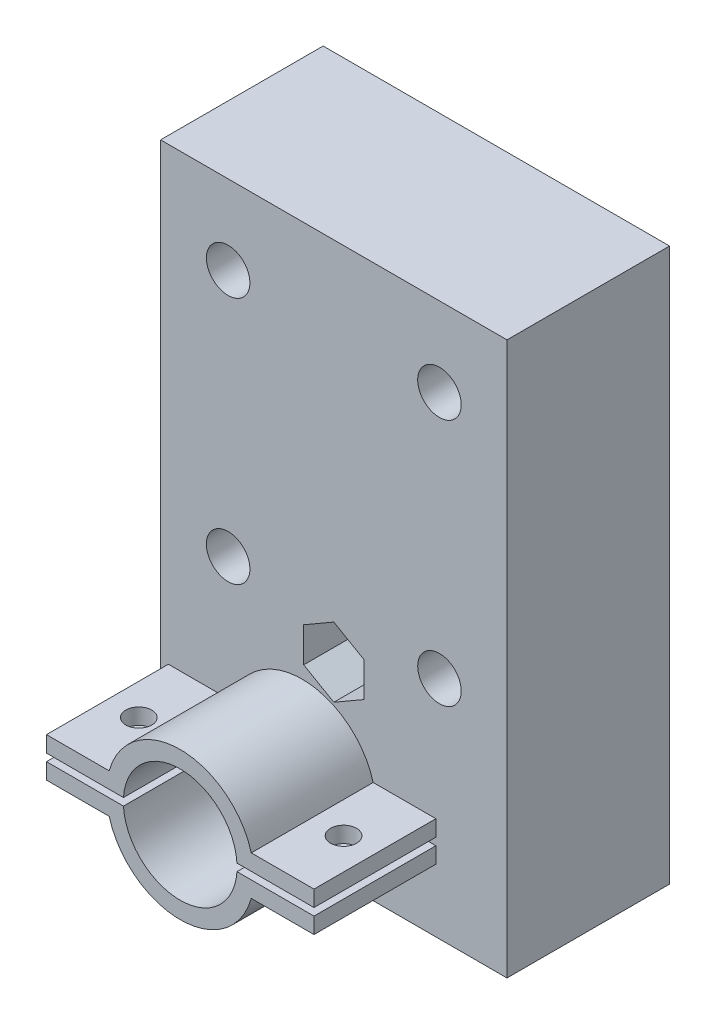
from build123d import *

# Parameters (mm, degrees)
SKETCH1_W           = 42.62295082
SKETCH1_H           = 50
SKETCH1_R           = 2.677018134
BOSS_EXTRUDE1_DEPTH = 20
SKETCH2_R           = 8.73
CUT_EXTRUDE2_DEPTH  = 7.94
SKETCH3_R           = 2.2
CUT_EXTRUDE3_DEPTH  = 10
CUT_EXTRUDE4_START  = -7
CUT_EXTRUDE4_DEPTH  = 32.460095998
SKETCH7_W           = 42.62295082
SKETCH7_H           = 20
BOSS_EXTRUDE2_DEPTH = 18
SKETCH6_R           = 6.4
CUT_EXTRUDE5_DEPTH  = 52.992105017
BOSS_EXTRUDE5_DEPTH = 15
SKETCH10_R          = 1.6
CUT_EXTRUDE8_DEPTH  = 80.392562524
SKETCH11_R          = 7
CUT_EXTRUDE9_DEPTH  = 52.992105017


with BuildPart() as part:
    # Sketch1 → Boss-Extrude1 (new body)
    with BuildSketch(Plane.XY):
        Rectangle(SKETCH1_W, SKETCH1_H)
        with Locations((-13, -15.25)):
            Circle(SKETCH1_R, mode=Mode.SUBTRACT)
        with Locations((13, -15.25)):
            Circle(SKETCH1_R, mode=Mode.SUBTRACT)
        with Locations((13, 15.25)):
            Circle(SKETCH1_R, mode=Mode.SUBTRACT)
        with Locations((-13, 15.25)):
            Circle(SKETCH1_R, mode=Mode.SUBTRACT)
    extrude(amount=BOSS_EXTRUDE1_DEPTH)

    # Sketch2 → Cut-Extrude2 (cut)
    with BuildSketch(Plane.XY):
        Circle(SKETCH2_R)
    extrude(amount=CUT_EXTRUDE2_DEPTH, mode=Mode.SUBTRACT)

    # Sketch3 → Cut-Extrude3 (cut)
    with BuildSketch(Plane(origin=(0, 0, 0), x_dir=(-1, 0, 0), z_dir=(0, 0, -1))):
        with Locations((0, -20)):
            Circle(SKETCH3_R)
    extrude(amount=-CUT_EXTRUDE3_DEPTH, mode=Mode.SUBTRACT)

    # Sketch5 → Cut-Extrude4 (cut, through all)
    with BuildSketch(Plane(origin=(0, 0, 0), x_dir=(-1, 0, 0), z_dir=(0, 0, -1)).offset(CUT_EXTRUDE4_START)):
        Polygon((0, -15.727608008), (-3.7, -17.863804004), (-3.7, -22.136195996), (0, -24.272391992), (3.7, -22.136195996), (3.7, -17.863804004), align=None)
    extrude(amount=-CUT_EXTRUDE4_DEPTH, mode=Mode.SUBTRACT)

    # Sketch7 → Boss-Extrude2 (add)
    with BuildSketch(Plane.XZ.offset(25)):
        with Locations((0, 10)):
            Rectangle(SKETCH7_W, SKETCH7_H)
    extrude(amount=BOSS_EXTRUDE2_DEPTH)

    # Sketch6 → Cut-Extrude5 (cut, through all)
    with BuildSketch(Plane(origin=(0, 0, 0), x_dir=(-1, 0, 0), z_dir=(0, 0, -1))):
        with Locations((3.896856088, -32.824049036)):
            Circle(SKETCH6_R)
    extrude(amount=-CUT_EXTRUDE5_DEPTH, mode=Mode.SUBTRACT)

    # Sketch8 → Boss-Extrude5 (add)
    with BuildSketch(Plane.XY.offset(20)):
        with BuildLine():
            ThreePointArc((-10.882067571, -32.369273769), (-3.896856088, -25.824049036), (3.088355395, -32.369273769))
            Line((3.088355395, -32.369273769), (12.561469986, -32.369273769))
            Line((12.561469986, -32.369273769), (12.561469986, -30.399273769))
            Line((12.561469986, -30.399273769), (4.845882313, -30.399273769))
            ThreePointArc((4.845882313, -30.399273769), (-3.896856088, -23.751287061), (-12.63959449, -30.399273769))
            Line((-12.63959449, -30.399273769), (-20.355182162, -30.399273769))
            Line((-20.355182162, -30.399273769), (-20.355182162, -32.369273769))
            Line((-20.355182162, -32.369273769), (-10.882067571, -32.369273769))
        make_face()
        with BuildLine():
            Line((-10.882067571, -33.278824303), (-20.355182162, -33.278824303))
            Line((-20.355182162, -33.278824303), (-20.355182162, -35.248824303))
            Line((-20.355182162, -35.248824303), (-12.63959449, -35.248824303))
            ThreePointArc((-12.63959449, -35.248824303), (-3.896856088, -41.896811011), (4.845882313, -35.248824303))
            Line((4.845882313, -35.248824303), (12.561469986, -35.248824303))
            Line((12.561469986, -35.248824303), (12.561469986, -33.278824303))
            Line((12.561469986, -33.278824303), (3.088355395, -33.278824303))
            ThreePointArc((3.088355395, -33.278824303), (-3.896856088, -39.824049036), (-10.882067571, -33.278824303))
        make_face()
    extrude(amount=BOSS_EXTRUDE5_DEPTH)

    # Sketch10 → Cut-Extrude8 (cut, through all)
    with BuildSketch(Plane.XZ.offset(43)):
        with Locations((-16.495182162, 27.5)):
            Circle(SKETCH10_R)
        with Locations((8.701469986, 27.5)):
            Circle(SKETCH10_R)
    extrude(amount=-CUT_EXTRUDE8_DEPTH, mode=Mode.SUBTRACT)

    # Sketch11 → Cut-Extrude9 (cut, through all)
    with BuildSketch(Plane.XY.offset(20)):
        with Locations((-3.896856088, -32.824049036)):
            Circle(SKETCH11_R)
    extrude(amount=-CUT_EXTRUDE9_DEPTH, mode=Mode.SUBTRACT)


solid = part.part
